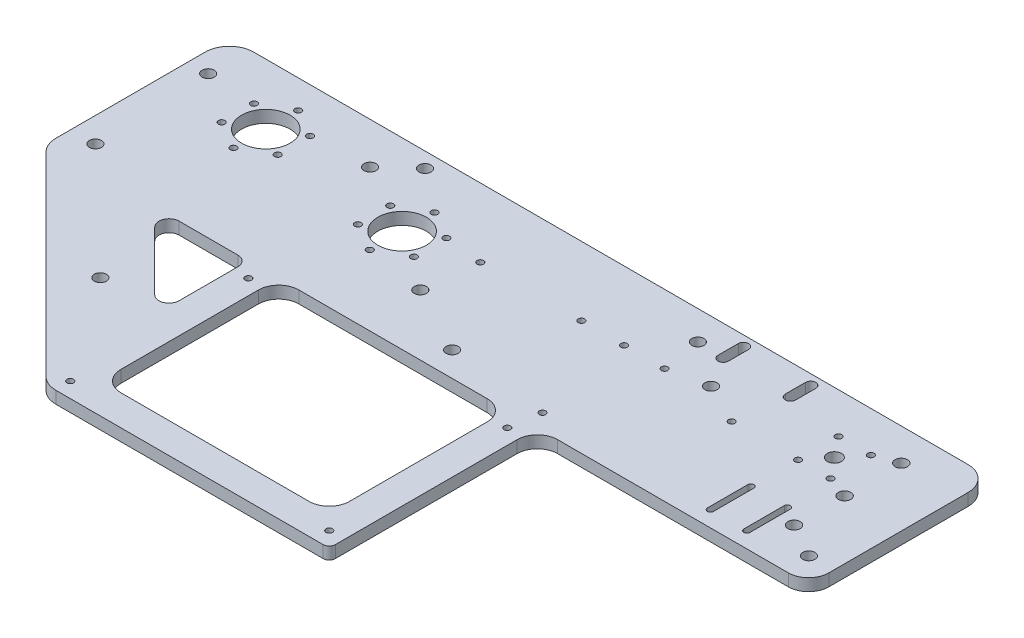
from build123d import *

# Parameters (mm, degrees)
ESBO_O1_R                = 1.6
ESBO_O1_R_2              = 3
ESBO_O1_R_3              = 12
ESBO_O1_R_4              = 3.5
ESBO_O1_R_5              = 3.05
RESSALTO_EXTRUS_O1_DEPTH = 6
ESBO_O2_R                = 3
CORTE_EXTRUS_O1_DEPTH    = 10


with BuildPart() as part:
    # Esboço1 → Ressalto-extrusão1 (new body)
    with BuildSketch(Plane(origin=(0, 0, 0), x_dir=(1, 0, 0), z_dir=(0, 1, 0))):
        with BuildLine():
            Line((-80.557360207, -153.648697641), (51.472077044, -153.648697641))
            ThreePointArc((51.472077044, -153.648697641), (53.593397388, -152.770017984), (54.472077044, -150.648697641))
            Line((54.472077044, -150.648697641), (54.472077044, -60.788592817))
            ThreePointArc((54.472077044, -60.788592817), (57.401009232, -53.717525005), (64.472077044, -50.788592817))
            Line((64.472077044, -50.788592817), (178.527922956, -50.788592817))
            ThreePointArc((178.527922956, -50.788592817), (185.598990768, -47.859660628), (188.527922956, -40.788592817))
            Line((188.527922956, -40.788592817), (188.527922956, 28))
            ThreePointArc((188.527922956, 28), (185.01320433, 36.485281374), (176.527922956, 40))
            Line((176.527922956, 40), (-176.527922956, 40))
            ThreePointArc((-176.527922956, 40), (-185.01320433, 36.485281374), (-188.527922956, 28))
            Line((-188.527922956, 28), (-188.527922956, -45.678134892))
            ThreePointArc((-188.527922956, -45.678134892), (-187.614477346, -50.270336081), (-185.01320433, -54.163416267))
            Line((-185.01320433, -54.163416267), (-89.042641582, -150.133979015))
            ThreePointArc((-89.042641582, -150.133979015), (-85.149561396, -152.735252031), (-80.557360207, -153.648697641))
        make_face()
        with Locations((-81.027922956, -58.148697641)):
            Circle(ESBO_O1_R, mode=Mode.SUBTRACT)
        with Locations((-81.027922956, -146.148697641)):
            Circle(ESBO_O1_R, mode=Mode.SUBTRACT)
        with Locations((46.972077044, -58.148697641)):
            Circle(ESBO_O1_R, mode=Mode.SUBTRACT)
        with Locations((46.972077044, -146.148697641)):
            Circle(ESBO_O1_R, mode=Mode.SUBTRACT)
        with Locations((176.311042956, -38.431817641)):
            Circle(ESBO_O1_R_2, mode=Mode.SUBTRACT)
        with Locations((0, -38.431817641)):
            Circle(ESBO_O1_R_2, mode=Mode.SUBTRACT)
        with Locations((-140.527922956, 10)):
            Circle(ESBO_O1_R_3, mode=Mode.SUBTRACT)
        with Locations((-140.527922956, -6)):
            Circle(ESBO_O1_R, mode=Mode.SUBTRACT)
        with Locations((-154.384329416, 2)):
            Circle(ESBO_O1_R, mode=Mode.SUBTRACT)
        with Locations((-154.384329416, 18)):
            Circle(ESBO_O1_R, mode=Mode.SUBTRACT)
        with Locations((-84.367438628, 32.5)):
            Circle(ESBO_O1_R_2, mode=Mode.SUBTRACT)
        with Locations((-176.311042956, -38.431817641)):
            Circle(ESBO_O1_R_2, mode=Mode.SUBTRACT)
        with Locations((140.527922956, 10)):
            Circle(ESBO_O1_R_4, mode=Mode.SUBTRACT)
        with Locations((148.527922956, 0)):
            Circle(ESBO_O1_R, mode=Mode.SUBTRACT)
        with Locations((148.527922956, 20)):
            Circle(ESBO_O1_R, mode=Mode.SUBTRACT)
        with Locations((132.527922956, 0)):
            Circle(ESBO_O1_R, mode=Mode.SUBTRACT)
        with Locations((132.527922956, 20)):
            Circle(ESBO_O1_R, mode=Mode.SUBTRACT)
        with Locations((-140.527922956, 26)):
            Circle(ESBO_O1_R, mode=Mode.SUBTRACT)
        with Locations((-126.671516495, 18)):
            Circle(ESBO_O1_R, mode=Mode.SUBTRACT)
        with Locations((-126.671516495, 2)):
            Circle(ESBO_O1_R, mode=Mode.SUBTRACT)
        with Locations((-63.17160518, -16)):
            Circle(ESBO_O1_R, mode=Mode.SUBTRACT)
        with Locations((-77.02801164, -8)):
            Circle(ESBO_O1_R, mode=Mode.SUBTRACT)
        with Locations((-77.02801164, 8)):
            Circle(ESBO_O1_R, mode=Mode.SUBTRACT)
        with Locations((-63.17160518, 16)):
            Circle(ESBO_O1_R, mode=Mode.SUBTRACT)
        with Locations((-49.315198719, 8)):
            Circle(ESBO_O1_R, mode=Mode.SUBTRACT)
        with Locations((-49.315198719, -8)):
            Circle(ESBO_O1_R, mode=Mode.SUBTRACT)
        with Locations((-63.17160518, 0)):
            Circle(ESBO_O1_R_3, mode=Mode.SUBTRACT)
        with Locations((-33.527922956, -20.648697641)):
            Circle(ESBO_O1_R_2, mode=Mode.SUBTRACT)
        with Locations((79.527922956, 10)):
            Circle(ESBO_O1_R_2, mode=Mode.SUBTRACT)
        with Locations((99.722077044, 0)):
            Circle(ESBO_O1_R, mode=Mode.SUBTRACT)
        with Locations((49.222077044, -43)):
            Circle(ESBO_O1_R, mode=Mode.SUBTRACT)
        with Locations((-30.527922956, 6)):
            Circle(ESBO_O1_R, mode=Mode.SUBTRACT)
        with Locations((19.472077044, 6)):
            Circle(ESBO_O1_R, mode=Mode.SUBTRACT)
        with Locations((60.527922956, 6)):
            Circle(ESBO_O1_R, mode=Mode.SUBTRACT)
        with Locations((40.527922956, 6)):
            Circle(ESBO_O1_R, mode=Mode.SUBTRACT)
        with Locations((159.467922956, 24.07)):
            Circle(ESBO_O1_R_5, mode=Mode.SUBTRACT)
        with Locations((159.467922956, -3.93)):
            Circle(ESBO_O1_R_5, mode=Mode.SUBTRACT)
        with Locations((159.467922956, -28.93)):
            Circle(ESBO_O1_R_5, mode=Mode.SUBTRACT)
        with Locations((-178.527922956, 19.5)):
            Circle(ESBO_O1_R_2, mode=Mode.SUBTRACT)
        with Locations((-98.527922956, 19.5)):
            Circle(ESBO_O1_R_2, mode=Mode.SUBTRACT)
        with Locations((57.327922956, 25.68)):
            Circle(ESBO_O1_R_2, mode=Mode.SUBTRACT)
        with BuildLine():
            Line((-122.576844598, -50.788592817), (-93.527922956, -50.788592817))
            ThreePointArc((-93.527922956, -50.788592817), (-89.99238905, -52.253058911), (-88.527922956, -55.788592817))
            Line((-88.527922956, -55.788592817), (-88.527922956, -84.837514459))
            ThreePointArc((-88.527922956, -84.837514459), (-91.614505794, -89.456912121), (-97.063456862, -88.373048365))
            Line((-97.063456862, -88.373048365), (-126.112378504, -59.324126723))
            ThreePointArc((-126.112378504, -59.324126723), (-127.196242261, -53.875175655), (-122.576844598, -50.788592817))
        make_face(mode=Mode.SUBTRACT)
        with BuildLine():
            Line((39.472077044, -60.648697641), (39.472077044, -128.648697641))
            ThreePointArc((39.472077044, -128.648697641), (36.543144856, -135.719765453), (29.472077044, -138.648697641))
            Line((29.472077044, -138.648697641), (-63.527922956, -138.648697641))
            ThreePointArc((-63.527922956, -138.648697641), (-70.598990768, -135.719765453), (-73.527922956, -128.648697641))
            Line((-73.527922956, -128.648697641), (-73.527922956, -60.648697641))
            ThreePointArc((-73.527922956, -60.648697641), (-70.598990768, -53.577629829), (-63.527922956, -50.648697641))
            Line((-63.527922956, -50.648697641), (29.472077044, -50.648697641))
            ThreePointArc((29.472077044, -50.648697641), (36.543144856, -53.577629829), (39.472077044, -60.648697641))
        make_face(mode=Mode.SUBTRACT)
        with BuildLine():
            Line((148.722077044, -43), (148.722077044, -23))
            ThreePointArc((148.722077044, -23), (150.222077044, -21.5), (151.722077044, -23))
            Line((151.722077044, -23), (151.722077044, -43))
            ThreePointArc((151.722077044, -43), (150.222077044, -44.5), (148.722077044, -43))
        make_face(mode=Mode.SUBTRACT)
        with BuildLine():
            Line((133.722077044, -43), (133.722077044, -23))
            ThreePointArc((133.722077044, -23), (132.222077044, -21.5), (130.722077044, -23))
            Line((130.722077044, -23), (130.722077044, -43))
            ThreePointArc((130.722077044, -43), (132.222077044, -44.5), (133.722077044, -43))
        make_face(mode=Mode.SUBTRACT)
        with BuildLine():
            Line((67.977922956, 25), (67.977922956, 35))
            ThreePointArc((67.977922956, 35), (70.527922956, 37.55), (73.077922956, 35))
            Line((73.077922956, 35), (73.077922956, 25))
            ThreePointArc((73.077922956, 25), (70.527922956, 22.45), (67.977922956, 25))
        make_face(mode=Mode.SUBTRACT)
        with BuildLine():
            Line((101.227922956, 25), (101.227922956, 35))
            ThreePointArc((101.227922956, 35), (103.777922956, 37.55), (106.327922956, 35))
            Line((106.327922956, 35), (106.327922956, 25))
            ThreePointArc((106.327922956, 25), (103.777922956, 22.45), (101.227922956, 25))
        make_face(mode=Mode.SUBTRACT)
    extrude(amount=-RESSALTO_EXTRUS_O1_DEPTH)

    # Esboço2 → Corte-extrusão1 (cut)
    with BuildSketch(Plane(origin=(0, 0, 0), x_dir=(1, 0, 0), z_dir=(0, 1, 0))):
        with Locations((-117.838060117, -94.468502794)):
            Circle(ESBO_O2_R)
    extrude(amount=-CORTE_EXTRUS_O1_DEPTH, mode=Mode.SUBTRACT)


solid = part.part
